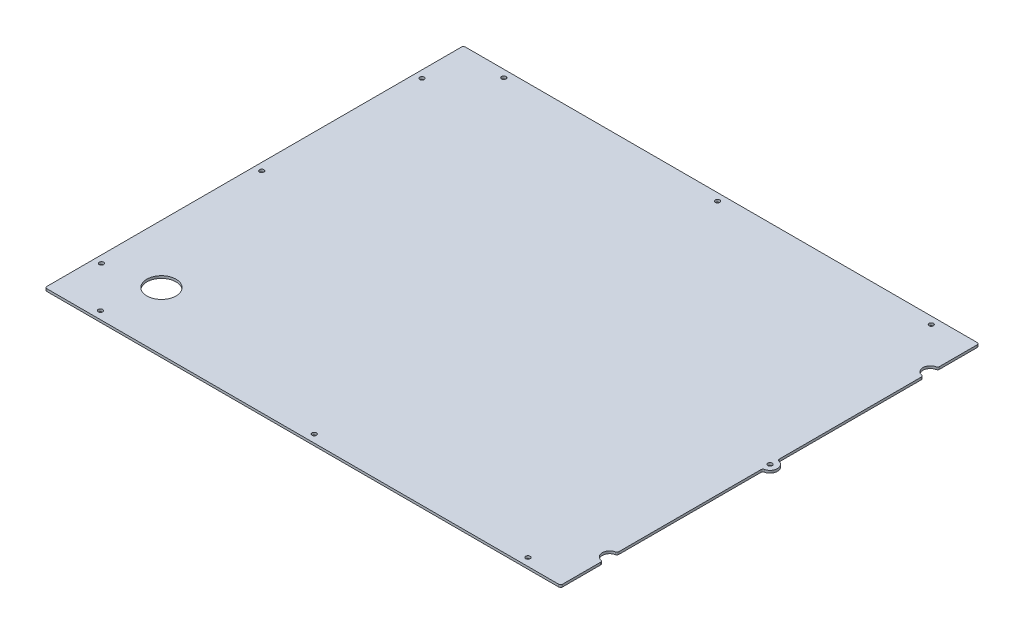
from build123d import *

# Parameters (mm, degrees)
BOSS_EXTRUDE1_DEPTH        = 3.175
F_1_0_228_DIAMETER_HOLE2_D = 5.7912
FILLET2_R                  = 2.54
CUT_EXTRUDE3_OUTLINE_R     = 2.8956
CUT_EXTRUDE3_OUTLINE_R_2   = 19.05
CUT_EXTRUDE3_DEPTH         = 3.175


# Read off the part's stored shape, not the designer's step: Cut-Extrude3
with BuildPart() as part:
    # Sketch1 → Boss-Extrude1 (new body)
    with BuildSketch(Plane(origin=(0, 0, 0), x_dir=(1, 0, 0), z_dir=(0, 1, 0))):
        with BuildLine():
            Line((337.058, 219.456), (337.058, 273.558))
            Line((337.058, 273.558), (-337.058, 273.558))
            Line((-337.058, 273.558), (-337.058, -273.558))
            Line((-337.058, -273.558), (337.058, -273.558))
            Line((337.058, -273.558), (337.058, -218.948))
            ThreePointArc((337.058, -218.948), (327.406, -209.296), (337.058, -199.644))
            Line((337.058, -199.644), (337.058, -9.398))
            ThreePointArc((337.058, -9.398), (346.71, 0.254), (337.058, 9.906))
            Line((337.058, 9.906), (337.058, 200.152))
            ThreePointArc((337.058, 200.152), (327.406, 209.804), (337.058, 219.456))
        make_face()
    extrude(amount=BOSS_EXTRUDE1_DEPTH)

    # #1 (0.228) Diameter Hole2 (through all)
    with Locations(Plane(origin=(0, 3.175, 0), x_dir=(1, 0, 0), z_dir=(0, 1, 0))):
        with Locations((337.058, 0.254)):
            Hole(F_1_0_228_DIAMETER_HOLE2_D / 2)

    # Fillet2
    fillet2_edges = [part.edges().sort_by_distance(p)[0] for p in [
        (337.058, 1.5875, -273.558),
        (337.058, 1.5875, -219.456),
        (337.058, 1.5875, -200.152),
        (337.058, 1.5875, -9.906),
        (337.058, 1.5875, 9.398),
        (337.058, 1.5875, 199.644),
        (337.058, 1.5875, 218.948),
        (337.058, 1.5875, 273.558),
        (-337.058, 1.5875, 273.558),
        (-337.058, 1.5875, -273.558),
    ]]
    fillet(fillet2_edges, radius=FILLET2_R)

    # Cut-Extrude3 outline → Cut-Extrude3 (cut)
    with BuildSketch(Plane(origin=(0, 0, 0), x_dir=(1, 0, 0), z_dir=(0, 1, 0))):
        with Locations((284.226, -263.398)):
            Circle(CUT_EXTRUDE3_OUTLINE_R)
        with Locations((4.826, -263.398)):
            Circle(CUT_EXTRUDE3_OUTLINE_R)
        with Locations((-274.574, -263.398)):
            Circle(CUT_EXTRUDE3_OUTLINE_R)
        with Locations((-327.406, -209.296)):
            Circle(CUT_EXTRUDE3_OUTLINE_R)
        with Locations((-327.406, 0.254)):
            Circle(CUT_EXTRUDE3_OUTLINE_R)
        with Locations((-327.406, 209.804)):
            Circle(CUT_EXTRUDE3_OUTLINE_R)
        with Locations((-274.574, 263.906)):
            Circle(CUT_EXTRUDE3_OUTLINE_R)
        with Locations((4.826, 263.906)):
            Circle(CUT_EXTRUDE3_OUTLINE_R)
        with Locations((284.226, 263.906)):
            Circle(CUT_EXTRUDE3_OUTLINE_R)
        with Locations((-260.858, -197.358)):
            Circle(CUT_EXTRUDE3_OUTLINE_R_2)
    extrude(amount=CUT_EXTRUDE3_DEPTH, mode=Mode.SUBTRACT)


solid = part.part
